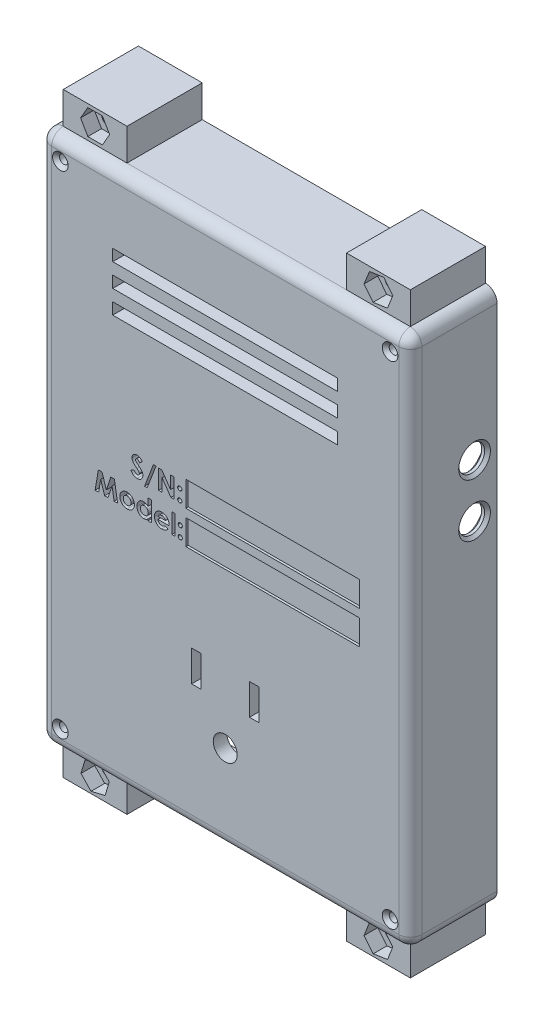
from build123d import *

# Parameters (mm, degrees)
SKETCH5_W                   = 81.28
SKETCH5_H                   = 116.84
CASE_2_DEPTH                = 12.7
CASE_CUT_DEPTH              = 9.7
SKETCH13_R                  = 2.159
BOARD_MOUNT_DEPTH           = 0.0001
SKETCH11_R                  = 0.8255
BOARD_MOUNT_SCREW_CUT_DEPTH = 5.588
SKETCH8_R                   = 0.9525
FACEPLATE_SCREW_CUT_DEPTH   = 73.289667311
SKETCH14_R                  = 2.6289
SKETCH14_W                  = 2.032
SKETCH14_H                  = 6.8072
OUTLET_CUT_DEPTH            = 72.823366671
SKETCH24_W                  = 81.28
SKETCH24_H                  = 116.84
BOSS_EXTRUDE1_DEPTH         = 6.35
CUT_EXTRUDE1_START          = -6.35
CUT_EXTRUDE1_DEPTH          = 6.35
FILLET11_R                  = 2.54
FILLET12_R                  = 2.54
FILLET13_R                  = 2.54
SKETCH28_R                  = 0.9525
CUT_EXTRUDE3_DEPTH          = 73.289667311
FILLET14_R                  = 2.54
SKETCH30_W                  = 79.248
SKETCH30_H                  = 114.808
CUT_EXTRUDE4_DEPTH          = 2.032
FILLET15_R                  = 2.54
FILLET16_R                  = 2.54
FILLET17_R                  = 2.54
FILLET18_R                  = 2.54
SKETCH18_R                  = 2.844
CUT_EXTRUDE5_DEPTH          = 2.54
CHAMFER6_SIZE               = 0.635
FILLET19_R                  = 2.54
CHAMFER7_SIZE               = 0.762
SKETCH31_W                  = 38.071387925
SKETCH31_H                  = 5.512590528
SKETCH31_H_2                = 5.504700738
CUT_EXTRUDE6_DEPTH          = 0.508
SKETCH32_W                  = 0.75982906
SKETCH32_H                  = 4.341880342
CUT_EXTRUDE7_DEPTH          = 1.905
SKETCH33_W                  = 49.388401948
SKETCH33_H                  = 2.54
CUT_EXTRUDE8_DEPTH          = 27.94
SKETCH34_W                  = 14
SKETCH34_H                  = 16.51
BOSS_EXTRUDE2_DEPTH         = 7
SKETCH35_W                  = 14
SKETCH35_H                  = 16.51
BOSS_EXTRUDE3_DEPTH         = 7
SKETCH36_R                  = 1.575
CUT_EXTRUDE9_DEPTH          = 16.51
CUT_EXTRUDE10_DEPTH         = 3


with BuildPart() as part:
    # Sketch5 → Case 2 (new body)
    with BuildSketch(Plane.XY):
        Rectangle(SKETCH5_W, SKETCH5_H)
    extrude(amount=CASE_2_DEPTH)

    # Sketch4 → Case Cut (cut)
    with BuildSketch(Plane.XY):
        with BuildLine():
            Line((-36.195, 56.515), (36.195, 56.515))
            ThreePointArc((36.195, 56.515), (34.398948776, 52.178948776), (38.735, 53.975))
            Line((38.735, 53.975), (38.735, -53.975))
            ThreePointArc((38.735, -53.975), (34.398948776, -52.178948776), (36.195, -56.515))
            Line((36.195, -56.515), (-36.195, -56.515))
            ThreePointArc((-36.195, -56.515), (-34.398948776, -52.178948776), (-38.735, -53.975))
            Line((-38.735, -53.975), (-38.735, 53.975))
            ThreePointArc((-38.735, 53.975), (-34.398948776, 52.178948776), (-36.195, 56.515))
        make_face()
    extrude(amount=CASE_CUT_DEPTH, mode=Mode.SUBTRACT)

    # Sketch13 → Board Mount (add)
    with BuildSketch(Plane(origin=(0, 0, 9.7), x_dir=(-1, 0, 0), z_dir=(0, 0, -1))):
        with Locations(Location((-35.56, 48.641, 0), (0, 0, 180))):
            Circle(SKETCH13_R)
        with Locations(Location((35.56, 48.641, 0), (0, 0, 180))):
            Circle(SKETCH13_R)
        with Locations(Location((-35.56, -48.641, 0), (0, 0, 180))):
            Circle(SKETCH13_R)
        with Locations(Location((35.56, -48.641, 0), (0, 0, 180))):
            Circle(SKETCH13_R)
    extrude(amount=BOARD_MOUNT_DEPTH)

    # Sketch11 → Board Mount Screw Cut (cut)
    with BuildSketch(Plane(origin=(0, 0, 9.7), x_dir=(-1, 0, 0), z_dir=(0, 0, -1))):
        with Locations((-35.56, 48.641)):
            Circle(SKETCH11_R)
        with Locations((35.56, 48.641)):
            Circle(SKETCH11_R)
        with Locations((35.56, -48.641)):
            Circle(SKETCH11_R)
        with Locations((-35.56, -48.641)):
            Circle(SKETCH11_R)
    extrude(amount=BOARD_MOUNT_SCREW_CUT_DEPTH, mode=Mode.SUBTRACT)

    # Sketch8 → FacePlate Screw Cut (cut, through all)
    with BuildSketch(Plane.XY):
        with Locations((-36.195, 53.975)):
            Circle(SKETCH8_R)
        with Locations((-36.195, -53.975)):
            Circle(SKETCH8_R)
        with Locations((36.195, 53.975)):
            Circle(SKETCH8_R)
        with Locations((36.195, -53.975)):
            Circle(SKETCH8_R)
    extrude(amount=FACEPLATE_SCREW_CUT_DEPTH, mode=Mode.SUBTRACT)

    # Sketch14 → Outlet Cut (cut, through all)
    with BuildSketch(Plane(origin=(0, 0, 9.7), x_dir=(-1, 0, 0), z_dir=(0, 0, -1))):
        with Locations((0, -39.497)):
            Circle(SKETCH14_R)
        with Locations((-6.35, -27.559)):
            Rectangle(SKETCH14_W, SKETCH14_H)
        with Locations((6.35, -27.559)):
            Rectangle(SKETCH14_W, SKETCH14_H)
    extrude(amount=-OUTLET_CUT_DEPTH, mode=Mode.SUBTRACT)

    # Sketch24 → Boss-Extrude1 (add)
    with BuildSketch(Plane.XY):
        Rectangle(SKETCH24_W, SKETCH24_H)
    extrude(amount=-BOSS_EXTRUDE1_DEPTH)

    # Sketch26 → Cut-Extrude1 (cut)
    with BuildSketch(Plane.XY.offset(CUT_EXTRUDE1_START)):
        with BuildLine():
            Line((-36.195, 56.515), (36.195, 56.515))
            ThreePointArc((36.195, 56.515), (34.398948776, 52.178948776), (38.735, 53.975))
            Line((38.735, 53.975), (38.735, -53.975))
            ThreePointArc((38.735, -53.975), (34.398948776, -52.178948776), (36.195, -56.515))
            Line((36.195, -56.515), (-36.195, -56.515))
            ThreePointArc((-36.195, -56.515), (-34.398948776, -52.178948776), (-38.735, -53.975))
            Line((-38.735, -53.975), (-38.735, 53.975))
            ThreePointArc((-38.735, 53.975), (-34.398948776, 52.178948776), (-36.195, 56.515))
        make_face()
    extrude(amount=CUT_EXTRUDE1_DEPTH, mode=Mode.SUBTRACT)

    # Fillet11
    fillet11_edges = [part.edges().sort_by_distance(p)[0] for p in [
        (40.64, -58.42, 3.175),
    ]]
    fillet(fillet11_edges, radius=FILLET11_R)

    # Fillet12
    fillet12_edges = [part.edges().sort_by_distance(p)[0] for p in [
        (40.64, 58.42, 3.175),
    ]]
    fillet(fillet12_edges, radius=FILLET12_R)

    # Fillet13
    fillet13_edges = [part.edges().sort_by_distance(p)[0] for p in [
        (-40.64, 58.42, 3.175),
    ]]
    fillet(fillet13_edges, radius=FILLET13_R)

    # Sketch28 → Cut-Extrude3 (cut, through all)
    with BuildSketch(Plane(origin=(0, 0, 0), x_dir=(-1, 0, 0), z_dir=(0, 0, -1))):
        with Locations((-36.195, 53.975)):
            Circle(SKETCH28_R)
        with Locations((-36.195, -53.975)):
            Circle(SKETCH28_R)
        with Locations((36.195, 53.975)):
            Circle(SKETCH28_R)
        with Locations((36.195, -53.975)):
            Circle(SKETCH28_R)
    extrude(amount=CUT_EXTRUDE3_DEPTH, mode=Mode.SUBTRACT)

    # Fillet14
    fillet14_edges = [part.edges().sort_by_distance(p)[0] for p in [
        (-40.64, -58.42, 3.175),
    ]]
    fillet(fillet14_edges, radius=FILLET14_R)

    # Sketch30 → Cut-Extrude4 (cut)
    with BuildSketch(Plane(origin=(0, 0, -6.35), x_dir=(-1, 0, 0), z_dir=(0, 0, -1))):
        Rectangle(SKETCH30_W, SKETCH30_H)
    extrude(amount=-CUT_EXTRUDE4_DEPTH, mode=Mode.SUBTRACT)

    # Fillet15
    fillet15_edges = [part.edges().sort_by_distance(p)[0] for p in [
        (39.624, 57.404, -5.334),
    ]]
    fillet(fillet15_edges, radius=FILLET15_R)

    # Fillet16
    fillet16_edges = [part.edges().sort_by_distance(p)[0] for p in [
        (-39.624, 57.404, -5.334),
    ]]
    fillet(fillet16_edges, radius=FILLET16_R)

    # Fillet17
    fillet17_edges = [part.edges().sort_by_distance(p)[0] for p in [
        (-39.624, -57.404, -5.334),
    ]]
    fillet(fillet17_edges, radius=FILLET17_R)

    # Fillet18
    fillet18_edges = [part.edges().sort_by_distance(p)[0] for p in [
        (39.624, -57.404, -5.334),
    ]]
    fillet(fillet18_edges, radius=FILLET18_R)

    # Sketch18 → Cut-Extrude5 (cut)
    with BuildSketch(Plane(origin=(40.64, 0, 0), x_dir=(0, 0, -1), z_dir=(1, 0, 0))):
        with Locations((1.4, 28.575)):
            Circle(SKETCH18_R)
        with Locations((1.4, 16.891)):
            Circle(SKETCH18_R)
    extrude(amount=-CUT_EXTRUDE5_DEPTH, mode=Mode.SUBTRACT)

    # Chamfer6
    # the kernel refuses this chamfer: 0.635 mm, written as the material it takes off along each edge
    with BuildSketch(Plane(origin=(38.735, 28.575, -1.4), x_dir=(0, 0, -1), z_dir=(0, -1, 0))) as chamfer6_piece_1:
        Polygon((2.844, CHAMFER6_SIZE), (2.844 + CHAMFER6_SIZE, 0), (2.844, 0), align=None)
    revolve(axis=Axis((38.735, 28.575, -1.4), (1, 0, 0)), mode=Mode.SUBTRACT)
    with BuildSketch(Plane(origin=(40.64, 28.575, -1.4), x_dir=(0, 0, -1), z_dir=(0, -1, 0))) as chamfer6_piece_2:
        Polygon((2.844 + CHAMFER6_SIZE, 0), (2.844, -CHAMFER6_SIZE), (2.844, 0), align=None)
    revolve(axis=Axis((40.64, 28.575, -1.4), (1, 0, 0)), mode=Mode.SUBTRACT)
    with BuildSketch(Plane(origin=(38.735, 16.891, -1.4), x_dir=(0, 0, -1), z_dir=(0, -1, 0))) as chamfer6_piece_3:
        Polygon((2.844, CHAMFER6_SIZE), (2.844 + CHAMFER6_SIZE, 0), (2.844, 0), align=None)
    revolve(axis=Axis((38.735, 16.891, -1.4), (1, 0, 0)), mode=Mode.SUBTRACT)
    with BuildSketch(Plane(origin=(40.64, 16.891, -1.4), x_dir=(0, 0, -1), z_dir=(0, -1, 0))) as chamfer6_piece_4:
        Polygon((2.844 + CHAMFER6_SIZE, 0), (2.844, -CHAMFER6_SIZE), (2.844, 0), align=None)
    revolve(axis=Axis((40.64, 16.891, -1.4), (1, 0, 0)), mode=Mode.SUBTRACT)

    # Fillet19
    fillet19_edges = [part.edges().sort_by_distance(p)[0] for p in [
        (40.64, 0, 12.7),
        (39.896051224, -57.676051224, 12.7),
        (0, 58.42, 12.7),
        (39.896051224, 57.676051224, 12.7),
        (-40.64, 0, 12.7),
        (-39.896051224, 57.676051224, 12.7),
        (0, -58.42, 12.7),
        (-39.896051224, -57.676051224, 12.7),
    ]]
    fillet(fillet19_edges, radius=FILLET19_R)

    # Chamfer7
    chamfer7_edges = [part.edges().sort_by_distance(p)[0] for p in [
        (-37.1475, 53.975, 12.7),
        (-37.1475, -53.975, 12.7),
        (35.2425, 53.975, 12.7),
        (35.2425, -53.975, 12.7),
    ]]
    chamfer(chamfer7_edges, length=CHAMFER7_SIZE)

    # Sketch31 → Cut-Extrude6 (cut)
    with BuildSketch(Plane.XY.offset(12.7)):
        with Locations((10.393000027, 4.552836284)):
            Rectangle(SKETCH31_W, SKETCH31_H)
        with Locations((10.393000027, -2.752350369)):
            Rectangle(SKETCH31_W, SKETCH31_H_2)
    extrude(amount=-CUT_EXTRUDE6_DEPTH, mode=Mode.SUBTRACT)

    # Sketch32 → Cut-Extrude7 (cut)
    # profile 1 of 12: a face of its own
    with BuildSketch(Plane.XY.offset(12.7)):
        with BuildLine():
            Line((-18.191123097, 5.877144928), (-18.759298845, 5.35730652))
            add(Edge.make_bspline(
                [(-18.759298845, 5.35730652), (-18.783637058, 5.3916381), (-18.830363032, 5.457549944), (-18.906100963, 5.545807458), (-18.981496898, 5.621097685), (-19.057249335, 5.683106097), (-19.134029715, 5.731455949), (-19.211704758, 5.765688177), (-19.289834103, 5.78744993), (-19.342324962, 5.790159792), (-19.368179721, 5.791494554)],
                knots=[0, 0, 0, 0, 1.299362458, 2.494594718, 3.587462134, 4.587049575, 5.512617175, 6.380583204, 7.202344345, 8, 8, 8, 8], degree=3))
            add(Edge.make_bspline(
                [(-19.368179721, 5.791494554), (-19.392296298, 5.790648788), (-19.438859073, 5.789015835), (-19.505237763, 5.772784401), (-19.564169709, 5.744771331), (-19.615597397, 5.708141885), (-19.656335713, 5.664011895), (-19.688862099, 5.617730882), (-19.707177188, 5.56664711), (-19.709587814, 5.531560715), (-19.710781217, 5.514190869)],
                knots=[0, 0, 0, 0, 1.185010067, 2.2879431, 3.333075148, 4.379039566, 5.372662701, 6.27520591, 7.14612461, 8, 8, 8, 8], degree=3))
            add(Edge.make_bspline(
                [(-19.710781217, 5.514190869), (-19.710033372, 5.496570541), (-19.708527316, 5.461085649), (-19.693980864, 5.409078121), (-19.672055208, 5.358260713), (-19.651104348, 5.327325738), (-19.640395266, 5.311513251)],
                knots=[0, 0, 0, 0, 0.967525499, 1.948461899, 2.951351359, 4, 4, 4, 4], degree=3))
            add(Edge.make_bspline(
                [(-19.640395266, 5.311513251), (-19.630659552, 5.29922237), (-19.608249223, 5.270930386), (-19.565517316, 5.226120294), (-19.511855016, 5.171224009), (-19.445197284, 5.108129253), (-19.368311265, 5.034566892), (-19.277633194, 4.95342869), (-19.175773181, 4.862201892), (-19.103373444, 4.798674854), (-19.06543533, 4.765386114)],
                knots=[0, 0, 0, 0, 0.473873513, 1.090794244, 1.870441696, 2.795289791, 3.865433203, 5.087734844, 6.473946851, 8, 8, 8, 8], degree=3))
            add(Edge.make_bspline(
                [(-19.06543533, 4.765386114), (-19.029824953, 4.734567129), (-18.962243855, 4.676079098), (-18.866089373, 4.593064728), (-18.781585599, 4.518378724), (-18.707501503, 4.453141963), (-18.64496013, 4.396669961), (-18.593698554, 4.348692783), (-18.553090703, 4.310144456), (-18.530007518, 4.286861243), (-18.520156217, 4.276924576)],
                knots=[0, 0, 0, 0, 1.543621617, 2.929473131, 4.163658386, 5.240097082, 6.164993805, 6.925417477, 7.541396219, 8, 8, 8, 8], degree=3))
            add(Edge.make_bspline(
                [(-18.520156217, 4.276924576), (-18.482782434, 4.236478138), (-18.410936897, 4.158725881), (-18.317563027, 4.038234335), (-18.240713312, 3.920610017), (-18.181260915, 3.803639635), (-18.136360074, 3.685635539), (-18.104704386, 3.563703686), (-18.085745583, 3.436569964), (-18.083640714, 3.349816718), (-18.082576089, 3.305937663)],
                knots=[0, 0, 0, 0, 1.206664779, 2.319633467, 3.337109185, 4.282041471, 5.190008762, 6.099243693, 7.03861361, 8, 8, 8, 8], degree=3))
            add(Edge.make_bspline(
                [(-18.082576089, 3.305937663), (-18.083333861, 3.263182906), (-18.08482064, 3.179296481), (-18.103030829, 3.056541193), (-18.128997489, 2.939059055), (-18.1691465, 2.828128438), (-18.218079878, 2.721928451), (-18.279424934, 2.622113351), (-18.351466291, 2.527672968), (-18.434036748, 2.440295541), (-18.525369477, 2.361006582), (-18.62333251, 2.290421678), (-18.728883778, 2.232144849), (-18.841121467, 2.184158037), (-18.959985499, 2.147197952), (-19.085334271, 2.119881006), (-19.217359513, 2.103485805), (-19.307640277, 2.101771881), (-19.353763321, 2.100896264)],
                knots=[0, 0, 0, 0, 1.043214005, 2.046824704, 3.02475056, 3.976699089, 4.921714032, 5.875962561, 6.831408892, 7.817874052, 8.806269674, 9.781291748, 10.760897367, 11.74438705, 12.757449933, 13.795994037, 14.874007457, 16, 16, 16, 16], degree=3))
            add(Edge.make_bspline(
                [(-19.353763321, 2.100896264), (-19.389969519, 2.101538586), (-19.461678554, 2.102810752), (-19.567366831, 2.113196929), (-19.66942081, 2.129959113), (-19.767725536, 2.153984331), (-19.862723889, 2.184427541), (-19.954419771, 2.221612755), (-20.042180175, 2.266116331), (-20.126669137, 2.317023097), (-20.207475937, 2.376132559), (-20.285622345, 2.442236243), (-20.360332136, 2.516350852), (-20.431964128, 2.598301108), (-20.500059997, 2.688319076), (-20.566848767, 2.785151087), (-20.629362144, 2.890594214), (-20.667979437, 2.96456342), (-20.687704294, 3.002345249)],
                knots=[0, 0, 0, 0, 1.016823716, 2.013894106, 2.979844003, 3.91962641, 4.853723003, 5.779685073, 6.695824784, 7.614987388, 8.547259901, 9.504950863, 10.487499108, 11.500346958, 12.559593716, 13.656357062, 14.802919212, 16, 16, 16, 16], degree=3))
            Line((-20.687704294, 3.002345249), (-20.019461772, 3.403460366))
            add(Edge.make_bspline(
                [(-20.019461772, 3.403460366), (-19.994788925, 3.360573054), (-19.947488968, 3.278354412), (-19.86733477, 3.167883246), (-19.785220886, 3.073282978), (-19.699248916, 2.996225674), (-19.610464248, 2.93568098), (-19.518438031, 2.892411542), (-19.423105609, 2.865627808), (-19.358169495, 2.862356896), (-19.325778546, 2.860725324)],
                knots=[0, 0, 0, 0, 1.283663364, 2.460892379, 3.537111102, 4.529833553, 5.449777664, 6.316464042, 7.160231139, 8, 8, 8, 8], degree=3))
            add(Edge.make_bspline(
                [(-19.325778546, 2.860725324), (-19.292832314, 2.862057754), (-19.228911825, 2.864642863), (-19.137673506, 2.888520734), (-19.054022761, 2.926010744), (-18.981715675, 2.979503818), (-18.920490593, 3.041242955), (-18.875302969, 3.109930569), (-18.846915798, 3.184248909), (-18.843914586, 3.235875316), (-18.842405148, 3.261840441)],
                knots=[0, 0, 0, 0, 1.13588714, 2.203786484, 3.234766741, 4.283437687, 5.291419208, 6.222934724, 7.106237994, 8, 8, 8, 8], degree=3))
            add(Edge.make_bspline(
                [(-18.842405148, 3.261840441), (-18.843799052, 3.285996764), (-18.846630635, 3.335068022), (-18.867487199, 3.408029092), (-18.90009237, 3.480956981), (-18.938666586, 3.540774409), (-18.977920682, 3.590857919), (-19.015456451, 3.634253015), (-19.061165088, 3.682197), (-19.114930696, 3.734750182), (-19.176042892, 3.792375201), (-19.244553154, 3.855066414), (-19.321245998, 3.922271587), (-19.375452651, 3.968051086), (-19.403796708, 3.991988678)],
                knots=[0, 0, 0, 0, 0.916159276, 1.861089862, 2.860218735, 3.940849679, 4.552606315, 5.27541173, 6.11797699, 7.06649574, 8.129236253, 9.306560635, 10.591630461, 12, 12, 12, 12], degree=3))
            add(Edge.make_bspline(
                [(-19.403796708, 3.991988678), (-19.457679889, 4.037579016), (-19.561098022, 4.125080674), (-19.707240965, 4.254317867), (-19.838928842, 4.375101866), (-19.955024255, 4.488925826), (-20.057006439, 4.59368768), (-20.144184727, 4.690238346), (-20.215601426, 4.779322579), (-20.290752102, 4.884836891), (-20.362160269, 5.013413331), (-20.42387719, 5.168105694), (-20.463916523, 5.322778428), (-20.468402374, 5.426617183), (-20.470610277, 5.477725858)],
                knots=[0, 0, 0, 0, 1.345494975, 2.582412109, 3.71882943, 4.751509156, 5.681369928, 6.505683931, 7.230279997, 7.856715994, 8.973648664, 10.023341002, 11.027102913, 12, 12, 12, 12], degree=3))
            add(Edge.make_bspline(
                [(-20.470610277, 5.477725858), (-20.469692013, 5.513969387), (-20.467882934, 5.585373032), (-20.451745677, 5.690361689), (-20.42762793, 5.791666921), (-20.392602038, 5.888919121), (-20.347142659, 5.981996477), (-20.29193401, 6.071354641), (-20.226118803, 6.156171181), (-20.151949509, 6.236389869), (-20.070233936, 6.309700622), (-19.982910462, 6.374404707), (-19.890473345, 6.429054718), (-19.793488069, 6.47439087), (-19.691353656, 6.509092815), (-19.584822526, 6.533691283), (-19.47374188, 6.548321668), (-19.398187222, 6.550310499), (-19.359699486, 6.551323614)],
                knots=[0, 0, 0, 0, 1.010766082, 1.991317756, 2.957454644, 3.913069143, 4.869106762, 5.843196583, 6.838735724, 7.860187025, 8.887984031, 9.89767229, 10.887916223, 11.879572884, 12.879850636, 13.892031539, 14.926195476, 16, 16, 16, 16], degree=3))
            add(Edge.make_bspline(
                [(-19.359699486, 6.551323614), (-19.309821285, 6.549498963), (-19.210458604, 6.545864065), (-19.063548015, 6.517440346), (-18.920051894, 6.472741054), (-18.80442003, 6.418816276), (-18.712413914, 6.366579318), (-18.641899821, 6.318486107), (-18.570147936, 6.263392749), (-18.496579624, 6.201125631), (-18.422561899, 6.130511557), (-18.345990082, 6.053231552), (-18.267907559, 5.968617736), (-18.217166299, 5.908170018), (-18.191123097, 5.877144928)],
                knots=[0, 0, 0, 0, 1.282922637, 2.555718331, 3.837320111, 5.142675274, 5.830281639, 6.55870424, 7.337177975, 8.157850921, 9.037902056, 9.96903443, 10.957596896, 12, 12, 12, 12], degree=3))
        make_face()
    # profile 2 of 12: a face of its own
    with BuildSketch(Plane.XY.offset(12.7)):
        Polygon((-17.702661559, 1.449614213), (-15.754751569, 6.551323614), (-15.17894361, 6.551323614), (-17.126853599, 1.449614213), align=None)
    # profile 3 of 12: a face of its own
    with BuildSketch(Plane.XY.offset(12.7)):
        Polygon((-14.609071815, 6.442776606), (-13.924716847, 6.442776606), (-12.00394361, 3.657019394), (-12.00394361, 6.442776606), (-11.24411455, 6.442776606), (-11.24411455, 2.209443272), (-11.933557659, 2.209443272), (-13.849242755, 4.986720249), (-13.849242755, 2.209443272), (-14.609071815, 2.209443272), align=None)
    # profile 4 of 12: a face of its own
    with BuildSketch(Plane.XY.offset(12.7)):
        with BuildLine():
            add(Edge.make_bspline(
                [(-9.9686872, 5.35730652), (-9.937984768, 5.355718732), (-9.87745762, 5.352588546), (-9.790545469, 5.326478209), (-9.711335748, 5.282486162), (-9.641172065, 5.223512547), (-9.581903266, 5.153199943), (-9.538407615, 5.073439373), (-9.511958455, 4.986110206), (-9.508913781, 4.925280522), (-9.507362413, 4.894285687)],
                knots=[0, 0, 0, 0, 1.013817282, 1.998651736, 2.969187861, 3.991244904, 5.013301947, 5.9920405, 6.976874954, 8, 8, 8, 8], degree=3))
            add(Edge.make_bspline(
                [(-9.507362413, 4.894285687), (-9.508893514, 4.863843269), (-9.511898432, 4.804097377), (-9.538799386, 4.718083569), (-9.581866264, 4.638752833), (-9.641182178, 4.568453843), (-9.711333192, 4.509476568), (-9.790546146, 4.465485454), (-9.877457444, 4.439374871), (-9.937984709, 4.436244719), (-9.9686872, 4.434656948)],
                knots=[0, 0, 0, 0, 1.009116963, 1.980479832, 2.963706907, 3.990451133, 5.017195359, 5.992182391, 6.981533323, 8, 8, 8, 8], degree=3))
            add(Edge.make_bspline(
                [(-9.9686872, 4.434656948), (-9.99940554, 4.436214655), (-10.059964051, 4.43928554), (-10.146757405, 4.465862547), (-10.226762822, 4.508213247), (-10.296884149, 4.566824871), (-10.356742443, 4.636055979), (-10.398546924, 4.716040624), (-10.425601169, 4.802663802), (-10.428518728, 4.863267593), (-10.430011986, 4.894285687)],
                knots=[0, 0, 0, 0, 1.016706445, 2.004347467, 2.981433789, 4.000427929, 5.018214116, 5.995300439, 6.973959266, 8, 8, 8, 8], degree=3))
            add(Edge.make_bspline(
                [(-10.430011986, 4.894285687), (-10.428481289, 4.92529182), (-10.425477182, 4.986143677), (-10.398772747, 5.073182383), (-10.35649654, 5.15345188), (-10.296961165, 5.223440376), (-10.226780242, 5.282779937), (-10.146985625, 5.326258075), (-10.059938403, 5.352626918), (-9.999396909, 5.355731645), (-9.9686872, 5.35730652)],
                knots=[0, 0, 0, 0, 1.022642663, 2.007012786, 2.980863166, 4.002438329, 5.024013493, 6.00229059, 6.986660713, 8, 8, 8, 8], degree=3))
        make_face()
    # profile 5 of 12: a face of its own
    with BuildSketch(Plane.XY.offset(12.7)):
        with BuildLine():
            add(Edge.make_bspline(
                [(-9.9686872, 3.077819341), (-9.938013801, 3.076137592), (-9.877623178, 3.072826519), (-9.790366961, 3.048116329), (-9.711617723, 3.003720953), (-9.641205382, 2.945814879), (-9.581666479, 2.87614614), (-9.538633107, 2.796697462), (-9.511835147, 2.709777455), (-9.508876633, 2.649196835), (-9.507362413, 2.618190601)],
                knots=[0, 0, 0, 0, 1.016957001, 2.002212695, 2.9757545, 3.99499976, 5.013036768, 5.994806404, 6.97370641, 8, 8, 8, 8], degree=3))
            add(Edge.make_bspline(
                [(-9.507362413, 2.618190601), (-9.508866713, 2.587179388), (-9.511805846, 2.526589038), (-9.538818546, 2.439499662), (-9.581602174, 2.359397988), (-9.641210159, 2.288982703), (-9.711326121, 2.229985335), (-9.790548019, 2.185999349), (-9.877456956, 2.159887412), (-9.937984545, 2.156757446), (-9.9686872, 2.155169768)],
                knots=[0, 0, 0, 0, 1.023218912, 1.999186227, 2.986238111, 4.008388923, 5.030539734, 6.0011649, 6.986089706, 8, 8, 8, 8], degree=3))
            add(Edge.make_bspline(
                [(-9.9686872, 2.155169768), (-9.99939713, 2.156744535), (-10.05993906, 2.15984905), (-10.146983091, 2.186219446), (-10.226789867, 2.229691667), (-10.296923446, 2.289054267), (-10.356797733, 2.359148641), (-10.398364982, 2.439752397), (-10.425629298, 2.526556205), (-10.428528251, 2.587168272), (-10.430011986, 2.618190601)],
                knots=[0, 0, 0, 0, 1.013427518, 1.99788335, 2.976245624, 3.997909735, 5.019573847, 6.001765691, 6.977268297, 8, 8, 8, 8], degree=3))
            add(Edge.make_bspline(
                [(-10.430011986, 2.618190601), (-10.428518462, 2.649208145), (-10.425600384, 2.70981086), (-10.398549893, 2.796441816), (-10.356731114, 2.876396841), (-10.296928439, 2.945743166), (-10.226496763, 3.004012328), (-10.147165165, 3.047899247), (-10.059772922, 3.072865165), (-9.999367907, 3.076150609), (-9.9686872, 3.077819341)],
                knots=[0, 0, 0, 0, 1.025808215, 2.00424526, 2.981110158, 3.998665696, 5.017428914, 5.998734231, 6.983523959, 8, 8, 8, 8], degree=3))
        make_face()
    # profile 6 of 12: a face of its own
    with BuildSketch(Plane.XY.offset(12.7)):
        Polygon((-27.846040786, -0.50739833), (-27.057378927, -0.50739833), (-26.091480156, -3.460216172), (-25.118797197, -0.50739833), (-24.337767549, -0.50739833), (-23.622035711, -4.740731663), (-24.39119303, -4.740731663), (-24.843189558, -2.066913554), (-25.723437955, -4.740731663), (-26.464610498, -4.740731663), (-27.339770754, -2.066913554), (-27.790919258, -4.740731663), (-28.5609246, -4.740731663), align=None)
    # profile 7 of 12: a face of its own
    with BuildSketch(Plane.XY.offset(12.7)):
        with BuildLine():
            add(Edge.make_bspline(
                [(-21.551162314, -1.592868415), (-21.515239063, -1.593507694), (-21.444094748, -1.594773756), (-21.338134179, -1.605312564), (-21.234026045, -1.622507064), (-21.131171946, -1.64477094), (-21.030526979, -1.67596596), (-20.931563274, -1.713379563), (-20.833395968, -1.756334754), (-20.738461555, -1.807466457), (-20.646074204, -1.862923452), (-20.558485498, -1.924097067), (-20.476422799, -1.990506806), (-20.398362745, -2.060612905), (-20.32794306, -2.137467555), (-20.260663549, -2.217367578), (-20.200159159, -2.303175512), (-20.14414081, -2.392800416), (-20.094268076, -2.485724008), (-20.050962779, -2.581299876), (-20.013377853, -2.678206618), (-19.983949609, -2.777624624), (-19.959585736, -2.878242935), (-19.9442104, -2.981294553), (-19.933279602, -3.085720881), (-19.932053913, -3.156029277), (-19.931437421, -3.191392721)],
                knots=[0, 0, 0, 0, 1.022364134, 2.024744242, 3.027414945, 4.024939316, 5.017584196, 6.023349371, 7.035562955, 8.064994934, 9.090267829, 10.101425541, 11.102933353, 12.093946398, 13.084502048, 14.067315274, 15.065326281, 16.070028806, 17.074376865, 18.064572984, 19.055292013, 20.030201733, 21.013838017, 21.999348303, 22.993720005, 24, 24, 24, 24], degree=3))
            add(Edge.make_bspline(
                [(-19.931437421, -3.191392721), (-19.932088026, -3.227032441), (-19.933381577, -3.297892285), (-19.943814937, -3.40330087), (-19.961075252, -3.506837093), (-19.983424577, -3.609110901), (-20.014502857, -3.708813605), (-20.050814509, -3.80741486), (-20.095388491, -3.903570696), (-20.144668312, -3.998330081), (-20.201046836, -4.088904537), (-20.261498852, -4.175572059), (-20.328496564, -4.256058952), (-20.39835252, -4.332861338), (-20.474380145, -4.403382103), (-20.555365899, -4.468766318), (-20.640608667, -4.529813333), (-20.730721437, -4.585090871), (-20.824550014, -4.633661272), (-20.920511996, -4.677451452), (-21.019168516, -4.713909903), (-21.120315399, -4.743640767), (-21.224013986, -4.76666063), (-21.33003534, -4.782298297), (-21.438151127, -4.793174114), (-21.510995288, -4.794390887), (-21.54777022, -4.795005167)],
                knots=[0, 0, 0, 0, 1.012026251, 2.012137606, 3.004615893, 3.992048833, 4.982446996, 5.968083444, 6.973977695, 7.990229942, 8.999482246, 10.001782172, 10.988562221, 11.971415814, 12.948383116, 13.930088534, 14.925840678, 15.924049238, 16.929462851, 17.924729459, 18.917889337, 19.913673841, 20.916777188, 21.931792057, 22.95587778, 24, 24, 24, 24], degree=3))
            add(Edge.make_bspline(
                [(-21.54777022, -4.795005167), (-21.60154267, -4.79342684), (-21.707528987, -4.790315933), (-21.863621774, -4.769007031), (-22.013575415, -4.732328824), (-22.157634258, -4.681200213), (-22.295985439, -4.615680802), (-22.427421539, -4.534590582), (-22.553249989, -4.439525987), (-22.671291347, -4.331290511), (-22.779433221, -4.212546392), (-22.873908159, -4.085787768), (-22.954125027, -3.952914539), (-23.020011653, -3.813775184), (-23.070862693, -3.668178905), (-23.107585821, -3.516560985), (-23.128920775, -3.358495247), (-23.132005371, -3.251100824), (-23.133574173, -3.196480862)],
                knots=[0, 0, 0, 0, 1.029999031, 2.030143771, 3.011211297, 3.982305373, 4.953580601, 5.938004764, 6.935448627, 7.970290061, 9.001484052, 10.007591832, 10.993831261, 11.969999897, 12.951306496, 13.942897864, 14.953773953, 16, 16, 16, 16], degree=3))
            add(Edge.make_bspline(
                [(-23.133574173, -3.196480862), (-23.131950663, -3.138158715), (-23.128759685, -3.023527704), (-23.103421921, -2.855590659), (-23.062960246, -2.694798898), (-23.00488006, -2.541602206), (-22.93068773, -2.395718032), (-22.840115709, -2.257454062), (-22.732716386, -2.126778977), (-22.65047001, -2.047742206), (-22.608647624, -2.007551909)],
                knots=[0, 0, 0, 0, 1.043912699, 2.05178951, 3.033892, 4.007821512, 4.978932272, 5.95884105, 6.962068106, 8, 8, 8, 8], degree=3))
            add(Edge.make_bspline(
                [(-22.608647624, -2.007551909), (-22.570271405, -1.974238673), (-22.494563068, -1.908518555), (-22.371561939, -1.825163359), (-22.245622662, -1.753169901), (-22.115235801, -1.693977887), (-21.980037872, -1.649348064), (-21.840721686, -1.616861546), (-21.697316213, -1.596907375), (-21.600127859, -1.594221577), (-21.551162314, -1.592868415)],
                knots=[0, 0, 0, 0, 1.048115528, 2.067714963, 3.060638214, 4.039924844, 5.017819947, 5.994373833, 6.98952318, 8, 8, 8, 8], degree=3))
        make_face()
        with BuildLine():
            add(Edge.make_bspline(
                [(-21.534201844, -2.298423971), (-21.56362034, -2.299401744), (-21.621530966, -2.301326502), (-21.706776929, -2.311656161), (-21.787403459, -2.332827684), (-21.865011949, -2.359752067), (-21.938229496, -2.395759635), (-22.009061269, -2.437896789), (-22.073824171, -2.490626251), (-22.135652287, -2.548466613), (-22.191778434, -2.612696784), (-22.239603241, -2.682675506), (-22.282335766, -2.755725542), (-22.314737673, -2.834521343), (-22.341553348, -2.916909192), (-22.359701875, -3.004220226), (-22.372331983, -3.095479133), (-22.373269589, -3.157992109), (-22.373745113, -3.189696674)],
                knots=[0, 0, 0, 0, 1.030650113, 2.02884584, 2.99876339, 3.944280128, 4.900564847, 5.851248946, 6.823638398, 7.81794922, 8.81432732, 9.802856497, 10.78262424, 11.771747962, 12.779760563, 13.812642396, 14.89064281, 16, 16, 16, 16], degree=3))
            add(Edge.make_bspline(
                [(-22.373745113, -3.189696674), (-22.373188686, -3.222519301), (-22.372101255, -3.286664822), (-22.360840683, -3.380325909), (-22.342271628, -3.46920966), (-22.31589082, -3.553178768), (-22.2827125, -3.632835954), (-22.242006549, -3.707734287), (-22.193343361, -3.777423431), (-22.138171117, -3.841817571), (-22.077759866, -3.900268844), (-22.011565941, -3.95042954), (-21.942361292, -3.994012527), (-21.868551071, -4.029016392), (-21.791183592, -4.056042216), (-21.710029185, -4.075940422), (-21.624661383, -4.08666061), (-21.566454033, -4.088507161), (-21.536745914, -4.089449612)],
                knots=[0, 0, 0, 0, 1.141730614, 2.231293227, 3.276944405, 4.297399982, 5.28939179, 6.275415646, 7.257752684, 8.24146775, 9.222424823, 10.176631434, 11.126518621, 12.063689483, 13.012557477, 13.974037417, 14.965980454, 16, 16, 16, 16], degree=3))
            add(Edge.make_bspline(
                [(-21.536745914, -4.089449612), (-21.507022937, -4.088613701), (-21.448748647, -4.086974829), (-21.363280596, -4.074702272), (-21.281711755, -4.055387685), (-21.203683498, -4.028129259), (-21.12982669, -3.992376154), (-21.059858602, -3.948584661), (-20.993163715, -3.897726275), (-20.93194174, -3.838172137), (-20.875269728, -3.773577175), (-20.825571763, -3.703520146), (-20.784042269, -3.628621795), (-20.749980648, -3.549353381), (-20.723548125, -3.465823859), (-20.705286485, -3.377722761), (-20.692649624, -3.285323118), (-20.691733222, -3.221965818), (-20.691266481, -3.189696674)],
                knots=[0, 0, 0, 0, 1.031504075, 2.022346795, 2.991027682, 3.937587355, 4.885570121, 5.833146507, 6.798790848, 7.791235734, 8.792807298, 9.778388351, 10.766749885, 11.760164525, 12.768777521, 13.802286646, 14.880660483, 16, 16, 16, 16], degree=3))
            add(Edge.make_bspline(
                [(-20.691266481, -3.189696674), (-20.691829987, -3.157438808), (-20.692935768, -3.09413841), (-20.704197143, -3.001613798), (-20.722583966, -2.913797467), (-20.749305028, -2.831064386), (-20.782286141, -2.752470701), (-20.823020228, -2.678418705), (-20.871923407, -2.609273122), (-20.927363859, -2.545376815), (-20.988680712, -2.487745746), (-21.053725352, -2.436352822), (-21.123985149, -2.393846926), (-21.198141987, -2.358806895), (-21.276393162, -2.331848592), (-21.358650825, -2.311837619), (-21.44516707, -2.301269974), (-21.504213412, -2.299382553), (-21.534201844, -2.298423971)],
                knots=[0, 0, 0, 0, 1.123894411, 2.205445421, 3.243160173, 4.246488011, 5.231014757, 6.210004299, 7.185865357, 8.177612767, 9.153374344, 10.115157457, 11.061423229, 12.009021698, 12.96873347, 13.94135618, 14.954456845, 16, 16, 16, 16], degree=3))
        make_face(mode=Mode.SUBTRACT)
    # profile 8 of 12: a face of its own
    with BuildSketch(Plane.XY.offset(12.7)):
        with BuildLine():
            Line((-16.946394686, -0.398851321), (-16.186565626, -0.398851321))
            Line((-16.186565626, -0.398851321), (-16.186565626, -4.740731663))
            Line((-16.186565626, -4.740731663), (-16.946394686, -4.740731663))
            Line((-16.946394686, -4.740731663), (-16.946394686, -4.403218308))
            add(Edge.make_bspline(
                [(-16.946394686, -4.403218308), (-16.984043936, -4.436071498), (-17.057113695, -4.499833051), (-17.172247992, -4.582565288), (-17.287718724, -4.65080869), (-17.404080732, -4.705160839), (-17.523122451, -4.745294306), (-17.645700933, -4.774351874), (-17.77358144, -4.791487833), (-17.860512847, -4.79382051), (-17.904661246, -4.795005167)],
                knots=[0, 0, 0, 0, 1.129196829, 2.191548051, 3.199897424, 4.157751732, 5.089409408, 6.034969131, 7.002052659, 8, 8, 8, 8], degree=3))
            add(Edge.make_bspline(
                [(-17.904661246, -4.795005167), (-17.954219786, -4.793890255), (-18.05215027, -4.791687126), (-18.195852383, -4.768495632), (-18.334611059, -4.732995882), (-18.468313666, -4.682759299), (-18.596716943, -4.617662535), (-18.720803565, -4.539404057), (-18.838446309, -4.445236524), (-18.95062451, -4.339234325), (-19.053334198, -4.222631151), (-19.143123977, -4.09704544), (-19.218810088, -3.964258346), (-19.280815668, -3.824710121), (-19.329591064, -3.678503184), (-19.364360942, -3.525173813), (-19.38487521, -3.364667245), (-19.387414299, -3.255336456), (-19.388702378, -3.199872956)],
                knots=[0, 0, 0, 0, 0.980476535, 1.937477201, 2.874147792, 3.812856188, 4.758993464, 5.720109578, 6.712210464, 7.737600662, 8.772720504, 9.783789959, 10.789002326, 11.793715968, 12.802552247, 13.835794126, 14.902098527, 16, 16, 16, 16], degree=3))
            add(Edge.make_bspline(
                [(-19.388702378, -3.199872956), (-19.387350534, -3.142440428), (-19.384698741, -3.029780126), (-19.365301036, -2.864456489), (-19.331172793, -2.707325328), (-19.28463648, -2.558168995), (-19.224775595, -2.41696172), (-19.151869036, -2.28347216), (-19.064924978, -2.158049238), (-18.964737365, -2.042827737), (-18.85655935, -1.937221667), (-18.740827998, -1.845283208), (-18.619353094, -1.767177209), (-18.492005551, -1.703412403), (-18.358803553, -1.654138188), (-18.220272981, -1.618114714), (-18.075798855, -1.596499364), (-17.97738191, -1.594088783), (-17.92755788, -1.592868415)],
                knots=[0, 0, 0, 0, 1.136281865, 2.228943489, 3.287578264, 4.313574083, 5.316051562, 6.317280042, 7.318008486, 8.329309503, 9.333984563, 10.305318864, 11.248632312, 12.186624717, 13.117503092, 14.05354244, 15.014596925, 16, 16, 16, 16], degree=3))
            add(Edge.make_bspline(
                [(-17.92755788, -1.592868415), (-17.881434439, -1.594331766), (-17.790225331, -1.597225542), (-17.655493768, -1.615441139), (-17.525856416, -1.64973952), (-17.399738834, -1.693930462), (-17.278778901, -1.753396397), (-17.162326753, -1.824829221), (-17.050075558, -1.909136112), (-16.98139189, -1.974331918), (-16.946394686, -2.007551909)],
                knots=[0, 0, 0, 0, 1.011899165, 2.001030639, 2.974036179, 3.948778736, 4.92769327, 5.924124564, 6.942254589, 8, 8, 8, 8], degree=3))
            Line((-16.946394686, -2.007551909), (-16.946394686, -0.398851321))
        make_face()
        with BuildLine():
            add(Edge.make_bspline(
                [(-17.768129461, -2.298423971), (-17.79840641, -2.299352972), (-17.857747251, -2.301173754), (-17.94501608, -2.312125884), (-18.0284189, -2.331424025), (-18.10736089, -2.359932884), (-18.183018575, -2.394660828), (-18.254243082, -2.438157006), (-18.321622248, -2.489568564), (-18.384759809, -2.54765083), (-18.442318998, -2.611493859), (-18.491938379, -2.681160437), (-18.534106836, -2.754773444), (-18.569770391, -2.83255421), (-18.595297405, -2.915423121), (-18.61551479, -3.002301372), (-18.626006304, -3.093898714), (-18.627908085, -3.156319468), (-18.628873318, -3.188000627)],
                knots=[0, 0, 0, 0, 1.04836806, 2.054732945, 3.03993516, 4.00574415, 4.955904794, 5.917688631, 6.888591924, 7.88601754, 8.884115178, 9.859153345, 10.841239365, 11.818093293, 12.814750328, 13.83810466, 14.90274714, 16, 16, 16, 16], degree=3))
            add(Edge.make_bspline(
                [(-18.628873318, -3.188000627), (-18.627922829, -3.219969152), (-18.6260499, -3.282962761), (-18.615345152, -3.37533276), (-18.595855273, -3.463480098), (-18.567420273, -3.546692165), (-18.532694543, -3.626091768), (-18.49042552, -3.701312468), (-18.438505428, -3.771024271), (-18.380895782, -3.836876791), (-18.316462964, -3.895680536), (-18.24870254, -3.947892862), (-18.176688955, -3.991578882), (-18.101203507, -4.0268862), (-18.022500282, -4.055658696), (-17.939592581, -4.074714299), (-17.853292589, -4.086896185), (-17.794459606, -4.088592592), (-17.764737367, -4.089449612)],
                knots=[0, 0, 0, 0, 1.099136573, 2.165835871, 3.191374663, 4.196217796, 5.183857741, 6.167377911, 7.154730987, 8.166690795, 9.170734848, 10.148332609, 11.103258353, 12.059567475, 13.009337315, 13.978056681, 14.978520572, 16, 16, 16, 16], degree=3))
            add(Edge.make_bspline(
                [(-17.764737367, -4.089449612), (-17.733896476, -4.088515402), (-17.673431562, -4.086683844), (-17.584738987, -4.075831664), (-17.500215768, -4.056462765), (-17.420213566, -4.027790686), (-17.343510425, -3.99331202), (-17.27079852, -3.95066579), (-17.202866887, -3.899372207), (-17.139371482, -3.840764877), (-17.081190184, -3.776400531), (-17.030884606, -3.705820387), (-16.987066608, -3.631281792), (-16.952605768, -3.551022381), (-16.925239029, -3.46644632), (-16.905604025, -3.377028712), (-16.894923721, -3.282673154), (-16.893067173, -3.218271809), (-16.892121182, -3.185456556)],
                knots=[0, 0, 0, 0, 1.050008698, 2.058587853, 3.036635738, 3.995319155, 4.947022481, 5.895997462, 6.858296291, 7.838991643, 8.833936038, 9.806048392, 10.784806122, 11.771666913, 12.772873988, 13.80724452, 14.882696879, 16, 16, 16, 16], degree=3))
            add(Edge.make_bspline(
                [(-16.892121182, -3.185456556), (-16.893055418, -3.153205711), (-16.894880252, -3.090210441), (-16.905650086, -2.997824982), (-16.925424488, -2.910163128), (-16.952227974, -2.827063744), (-16.987301883, -2.748716836), (-17.031153035, -2.675991084), (-17.080906789, -2.606366815), (-17.139732239, -2.543741306), (-17.202883675, -2.485558337), (-17.271814353, -2.43581591), (-17.344352582, -2.392946505), (-17.42094404, -2.357749071), (-17.502297928, -2.331948017), (-17.586965592, -2.311971205), (-17.676268023, -2.301180327), (-17.73700929, -2.29935775), (-17.768129461, -2.298423971)],
                knots=[0, 0, 0, 0, 1.106611376, 2.161533483, 3.185006901, 4.184773755, 5.152708835, 6.122342771, 7.094156588, 8.082475533, 9.064254463, 10.03606828, 10.992420271, 11.951521816, 12.920622147, 13.915721683, 14.932141191, 16, 16, 16, 16], degree=3))
        make_face(mode=Mode.SUBTRACT)
    # profile 9 of 12: a face of its own
    with BuildSketch(Plane.XY.offset(12.7)):
        with BuildLine():
            Line((-12.335690893, -3.383894056), (-14.775454515, -3.383894056))
            add(Edge.make_bspline(
                [(-14.775454515, -3.383894056), (-14.770480034, -3.412242725), (-14.760704786, -3.467950097), (-14.739477488, -3.548869888), (-14.712388273, -3.625127333), (-14.679923554, -3.69682437), (-14.642630686, -3.764340033), (-14.599131646, -3.827357646), (-14.549978179, -3.88582155), (-14.495454477, -3.939477652), (-14.436469351, -3.987554683), (-14.373308857, -4.029673202), (-14.305907818, -4.06420781), (-14.235038961, -4.093316901), (-14.160172733, -4.116374251), (-14.08119895, -4.132276466), (-13.998326958, -4.141669963), (-13.941872026, -4.143028625), (-13.913014611, -4.143723116)],
                knots=[0, 0, 0, 0, 1.091296461, 2.144483647, 3.168565212, 4.157007626, 5.126487748, 6.090021542, 7.05641414, 8.019231907, 8.98705074, 9.938580405, 10.892824166, 11.854447369, 12.841318655, 13.858982407, 14.905600794, 16, 16, 16, 16], degree=3))
            add(Edge.make_bspline(
                [(-13.913014611, -4.143723116), (-13.878181752, -4.142803495), (-13.809585595, -4.14099249), (-13.709091714, -4.124931567), (-13.611899493, -4.100672249), (-13.518928712, -4.064596607), (-13.42910245, -4.019688774), (-13.343899525, -3.96373914), (-13.261845139, -3.898382736), (-13.211782294, -3.848006044), (-13.186258468, -3.822322208)],
                knots=[0, 0, 0, 0, 1.021034703, 2.010718019, 2.977989445, 3.954245119, 4.929443971, 5.918328161, 6.938689359, 8, 8, 8, 8], degree=3))
            Line((-13.186258468, -3.822322208), (-12.55024084, -4.125066599))
            add(Edge.make_bspline(
                [(-12.55024084, -4.125066599), (-12.570265484, -4.152737584), (-12.609943579, -4.207566622), (-12.674716738, -4.284725239), (-12.742311654, -4.356717359), (-12.812778739, -4.423069479), (-12.886207363, -4.483592521), (-12.962393265, -4.539023765), (-13.042449872, -4.587874905), (-13.124776465, -4.63250933), (-13.211074888, -4.670774215), (-13.301106315, -4.703405158), (-13.394489412, -4.732903254), (-13.492403407, -4.755379186), (-13.594032969, -4.773170951), (-13.699621217, -4.785805461), (-13.809154235, -4.793609193), (-13.88360319, -4.794534315), (-13.921494846, -4.795005167)],
                knots=[0, 0, 0, 0, 1.028154879, 2.037251081, 3.030720504, 4.000128189, 4.949298328, 5.894184978, 6.834267904, 7.770992897, 8.712077017, 9.673380525, 10.653304757, 11.658697181, 12.695551717, 13.758623199, 14.859225354, 16, 16, 16, 16], degree=3))
            add(Edge.make_bspline(
                [(-13.921494846, -4.795005167), (-13.979790537, -4.793816694), (-14.093959288, -4.791489136), (-14.260951725, -4.769886073), (-14.419548223, -4.734065865), (-14.570196604, -4.685373795), (-14.712245664, -4.621085007), (-14.845765704, -4.542454487), (-14.97209078, -4.450989738), (-15.087360956, -4.34477116), (-15.192375488, -4.229158553), (-15.284613723, -4.104998507), (-15.361797364, -3.973158482), (-15.425182123, -3.834511024), (-15.474446959, -3.688701248), (-15.509964049, -3.535665527), (-15.53173645, -3.375476953), (-15.534087977, -3.266370652), (-15.535283575, -3.210897261)],
                knots=[0, 0, 0, 0, 1.103565453, 2.161269334, 3.182010356, 4.179077853, 5.15417608, 6.128274628, 7.109042802, 8.101804412, 9.090965879, 10.063106201, 11.02526161, 11.978650795, 12.945248442, 13.93468508, 14.949922959, 16, 16, 16, 16], degree=3))
            add(Edge.make_bspline(
                [(-15.535283575, -3.210897261), (-15.53407621, -3.154014221), (-15.531700775, -3.042099393), (-15.510151509, -2.878211991), (-15.474348767, -2.721841244), (-15.42493982, -2.57277181), (-15.362516616, -2.430537467), (-15.284350945, -2.296382593), (-15.19242126, -2.169840134), (-15.087785042, -2.051502068), (-14.972026546, -1.944689036), (-14.849022207, -1.849497278), (-14.717389946, -1.770177187), (-14.578618636, -1.706086603), (-14.43359591, -1.654014621), (-14.280645507, -1.619365065), (-14.120931147, -1.596099963), (-14.011753927, -1.593957392), (-13.95626381, -1.592868415)],
                knots=[0, 0, 0, 0, 1.079208495, 2.12329425, 3.130605359, 4.119693003, 5.099659317, 6.073216462, 7.060498243, 8.06384408, 9.066070512, 10.045757761, 11.010926815, 11.975797609, 12.942977511, 13.929384301, 14.947594487, 16, 16, 16, 16], degree=3))
            add(Edge.make_bspline(
                [(-13.95626381, -1.592868415), (-13.897688843, -1.594075327), (-13.782682932, -1.596444975), (-13.614527444, -1.617872626), (-13.454877884, -1.653911261), (-13.303054056, -1.702182301), (-13.160994812, -1.768095091), (-13.02557868, -1.844790638), (-12.900053706, -1.938232467), (-12.783081929, -2.043931245), (-12.677490994, -2.161200377), (-12.585192817, -2.288590571), (-12.506658429, -2.424858574), (-12.443005527, -2.570556982), (-12.393791277, -2.725248393), (-12.35824131, -2.888731911), (-12.33663498, -3.061629348), (-12.334327209, -3.180022133), (-12.333146823, -3.240578084)],
                knots=[0, 0, 0, 0, 1.080001299, 2.120471247, 3.119684163, 4.095710327, 5.052285597, 6.002875087, 6.961153713, 7.931888285, 8.906493152, 9.865905668, 10.82813294, 11.801621613, 12.7925306, 13.817193356, 14.883530496, 16, 16, 16, 16], degree=3))
            Line((-12.333146823, -3.240578084), (-12.335690893, -3.383894056))
        make_face()
        with BuildLine():
            add(Edge.make_bspline(
                [(-13.092975882, -2.786885509), (-13.107314321, -2.74819187), (-13.135822874, -2.671258837), (-13.200222506, -2.565110022), (-13.285678758, -2.473180837), (-13.38507051, -2.391795201), (-13.49863181, -2.325737535), (-13.622784142, -2.27790964), (-13.755958246, -2.249231433), (-13.847574853, -2.245867984), (-13.894358094, -2.244150467)],
                knots=[0, 0, 0, 0, 0.954238005, 1.897273737, 2.851915805, 3.847685534, 4.862635127, 5.880135777, 6.917509367, 8, 8, 8, 8], degree=3))
            add(Edge.make_bspline(
                [(-13.894358094, -2.244150467), (-13.94545301, -2.245800351), (-14.045332932, -2.249025531), (-14.18940292, -2.283326505), (-14.325300534, -2.334519684), (-14.405418065, -2.387300939), (-14.445573372, -2.413755167)],
                knots=[0, 0, 0, 0, 1.044195649, 2.041185066, 3.018232172, 4, 4, 4, 4], degree=3))
            add(Edge.make_bspline(
                [(-14.445573372, -2.413755167), (-14.470627284, -2.433903287), (-14.524040944, -2.476858049), (-14.593409419, -2.56254872), (-14.661737944, -2.666300887), (-14.700586477, -2.745107987), (-14.721181011, -2.786885509)],
                knots=[0, 0, 0, 0, 0.82159062, 1.751589201, 2.808063854, 4, 4, 4, 4], degree=3))
            Line((-14.721181011, -2.786885509), (-13.092975882, -2.786885509))
        make_face(mode=Mode.SUBTRACT)
    # profile 10 of 12: a face of its own
    with BuildSketch(Plane.XY.offset(12.7)):
        with Locations((-11.356223746, -2.569791492)):
            Rectangle(SKETCH32_W, SKETCH32_H)
    # profile 11 of 12: a face of its own
    with BuildSketch(Plane.XY.offset(12.7)):
        with BuildLine():
            add(Edge.make_bspline(
                [(-9.863702378, -1.592868415), (-9.832999946, -1.594456204), (-9.772472798, -1.59758639), (-9.685560648, -1.623696726), (-9.606350926, -1.667688774), (-9.536187244, -1.726662389), (-9.476918445, -1.796974993), (-9.433422794, -1.876735562), (-9.406973634, -1.96406473), (-9.403928959, -2.024894414), (-9.402377592, -2.055889249)],
                knots=[0, 0, 0, 0, 1.013817282, 1.998651736, 2.969187861, 3.991244904, 5.013301947, 5.9920405, 6.976874954, 8, 8, 8, 8], degree=3))
            add(Edge.make_bspline(
                [(-9.402377592, -2.055889249), (-9.403908692, -2.086331666), (-9.40691361, -2.146077559), (-9.433814564, -2.232091366), (-9.476881443, -2.311422103), (-9.536197356, -2.381721092), (-9.60634837, -2.440698368), (-9.685561325, -2.484689481), (-9.772472622, -2.510800064), (-9.832999887, -2.513930216), (-9.863702378, -2.515517988)],
                knots=[0, 0, 0, 0, 1.009116963, 1.980479832, 2.963706907, 3.990451133, 5.017195359, 5.992182391, 6.981533323, 8, 8, 8, 8], degree=3))
            add(Edge.make_bspline(
                [(-9.863702378, -2.515517988), (-9.894420719, -2.51396028), (-9.954979229, -2.510889396), (-10.041772583, -2.484312389), (-10.121778001, -2.441961688), (-10.191899327, -2.383350065), (-10.251757621, -2.314118957), (-10.293562102, -2.234134311), (-10.320616348, -2.147511134), (-10.323533906, -2.086907342), (-10.325027164, -2.055889249)],
                knots=[0, 0, 0, 0, 1.016706445, 2.004347467, 2.981433789, 4.000427929, 5.018214116, 5.995300439, 6.973959266, 8, 8, 8, 8], degree=3))
            add(Edge.make_bspline(
                [(-10.325027164, -2.055889249), (-10.323496468, -2.024883116), (-10.320492361, -1.964031258), (-10.293787926, -1.876992552), (-10.251511718, -1.796723055), (-10.191976343, -1.726734559), (-10.121795421, -1.667394998), (-10.042000804, -1.62391686), (-9.954953581, -1.597548017), (-9.894412087, -1.59444329), (-9.863702378, -1.592868415)],
                knots=[0, 0, 0, 0, 1.022642663, 2.007012786, 2.980863166, 4.002438329, 5.024013493, 6.00229059, 6.986660713, 8, 8, 8, 8], degree=3))
        make_face()
    # profile 12 of 12: a face of its own
    with BuildSketch(Plane.XY.offset(12.7)):
        with BuildLine():
            add(Edge.make_bspline(
                [(-9.863702378, -3.872355595), (-9.83302898, -3.874037344), (-9.772638356, -3.877348416), (-9.68538214, -3.902058606), (-9.606632901, -3.946453983), (-9.53622056, -4.004360057), (-9.476681658, -4.074028795), (-9.433648285, -4.153477474), (-9.406850325, -4.24039748), (-9.403891811, -4.3009781), (-9.402377592, -4.331984334)],
                knots=[0, 0, 0, 0, 1.016957001, 2.002212695, 2.9757545, 3.99499976, 5.013036768, 5.994806404, 6.97370641, 8, 8, 8, 8], degree=3))
            add(Edge.make_bspline(
                [(-9.402377592, -4.331984334), (-9.403881892, -4.362995548), (-9.406821024, -4.423585897), (-9.433833725, -4.510675274), (-9.476617352, -4.590776948), (-9.536225337, -4.661192232), (-9.606341299, -4.720189601), (-9.685563198, -4.764175587), (-9.772472135, -4.790287523), (-9.832999723, -4.79341749), (-9.863702378, -4.795005167)],
                knots=[0, 0, 0, 0, 1.023218912, 1.999186227, 2.986238111, 4.008388923, 5.030539734, 6.0011649, 6.986089706, 8, 8, 8, 8], degree=3))
            add(Edge.make_bspline(
                [(-9.863702378, -4.795005167), (-9.894412308, -4.7934304), (-9.954954238, -4.790325885), (-10.041998269, -4.763955489), (-10.121805045, -4.720483268), (-10.191938625, -4.661120669), (-10.251812912, -4.591026294), (-10.293380161, -4.510422539), (-10.320644477, -4.423618731), (-10.323543429, -4.363006663), (-10.325027164, -4.331984334)],
                knots=[0, 0, 0, 0, 1.013427518, 1.99788335, 2.976245624, 3.997909735, 5.019573847, 6.001765691, 6.977268297, 8, 8, 8, 8], degree=3))
            add(Edge.make_bspline(
                [(-10.325027164, -4.331984334), (-10.323533641, -4.300966791), (-10.320615563, -4.240364075), (-10.293565072, -4.15373312), (-10.251746293, -4.073778094), (-10.191943618, -4.004431769), (-10.121511941, -3.946162608), (-10.042180344, -3.902275688), (-9.954788101, -3.87730977), (-9.894383086, -3.874024326), (-9.863702378, -3.872355595)],
                knots=[0, 0, 0, 0, 1.025808215, 2.00424526, 2.981110158, 3.998665696, 5.017428914, 5.998734231, 6.983523959, 8, 8, 8, 8], degree=3))
        make_face()
    extrude(amount=-CUT_EXTRUDE7_DEPTH, mode=Mode.SUBTRACT)

    # Sketch33 → Cut-Extrude8 (cut)
    with BuildSketch(Plane.XY.offset(12.7)):
        with Locations((0, 41.91)):
            Rectangle(SKETCH33_W, SKETCH33_H)
        with Locations((0, 36.83)):
            Rectangle(SKETCH33_W, SKETCH33_H)
        with Locations((0, 31.75)):
            Rectangle(SKETCH33_W, SKETCH33_H)
    extrude(amount=-CUT_EXTRUDE8_DEPTH, mode=Mode.SUBTRACT)

    # Sketch34 → Boss-Extrude2 (add)
    with BuildSketch(Plane(origin=(0, 58.42, 0), x_dir=(1, 0, 0), z_dir=(0, 1, 0))):
        with Locations((-31.1, -1.905)):
            Rectangle(SKETCH34_W, SKETCH34_H)
        with Locations((31.1, -1.905)):
            Rectangle(SKETCH34_W, SKETCH34_H)
    extrude(amount=BOSS_EXTRUDE2_DEPTH)

    # Sketch35 → Boss-Extrude3 (add)
    with BuildSketch(Plane.XZ.offset(58.42)):
        with Locations((-31.1, 1.905)):
            Rectangle(SKETCH35_W, SKETCH35_H)
        with Locations((31.1, 1.905)):
            Rectangle(SKETCH35_W, SKETCH35_H)
    extrude(amount=BOSS_EXTRUDE3_DEPTH)

    # Sketch36 → Cut-Extrude9 (cut)
    with BuildSketch(Plane.XY.offset(10.16)):
        with Locations((-31.1, -61.92)):
            Circle(SKETCH36_R)
        with Locations((31.1, -61.92)):
            Circle(SKETCH36_R)
        with Locations((31.1, 61.92)):
            Circle(SKETCH36_R)
        with Locations((-31.1, 61.92)):
            Circle(SKETCH36_R)
    extrude(amount=-CUT_EXTRUDE9_DEPTH, mode=Mode.SUBTRACT)

    # Sketch38 → Cut-Extrude10 (cut)
    with BuildSketch(Plane.XY.offset(10.16)):
        Polygon((-28.001483791, -61.174347733), (-30.196495701, -58.863780116), (-33.29501191, -59.609432383), (-34.198516209, -62.665652267), (-32.003504299, -64.976219884), (-28.90498809, -64.230567617), align=None)
        Polygon((34.248478103, -61.426152214), (32.246554324, -58.946414087), (29.098076221, -59.440261872), (27.951521897, -62.413847786), (29.953445676, -64.893585913), (33.101923779, -64.399738128), align=None)
        Polygon((34.254418284, 62.37436251), (32.283719666, 64.878987623), (29.129301382, 64.424625113), (27.945581716, 61.46563749), (29.916280334, 58.961012377), (33.070698618, 59.415374887), align=None)
        Polygon((-27.913026514, 61.92), (-29.506513257, 64.68), (-32.693486743, 64.68), (-34.286973486, 61.92), (-32.693486743, 59.16), (-29.506513257, 59.16), align=None)
    extrude(amount=-CUT_EXTRUDE10_DEPTH, mode=Mode.SUBTRACT)


solid = part.part
